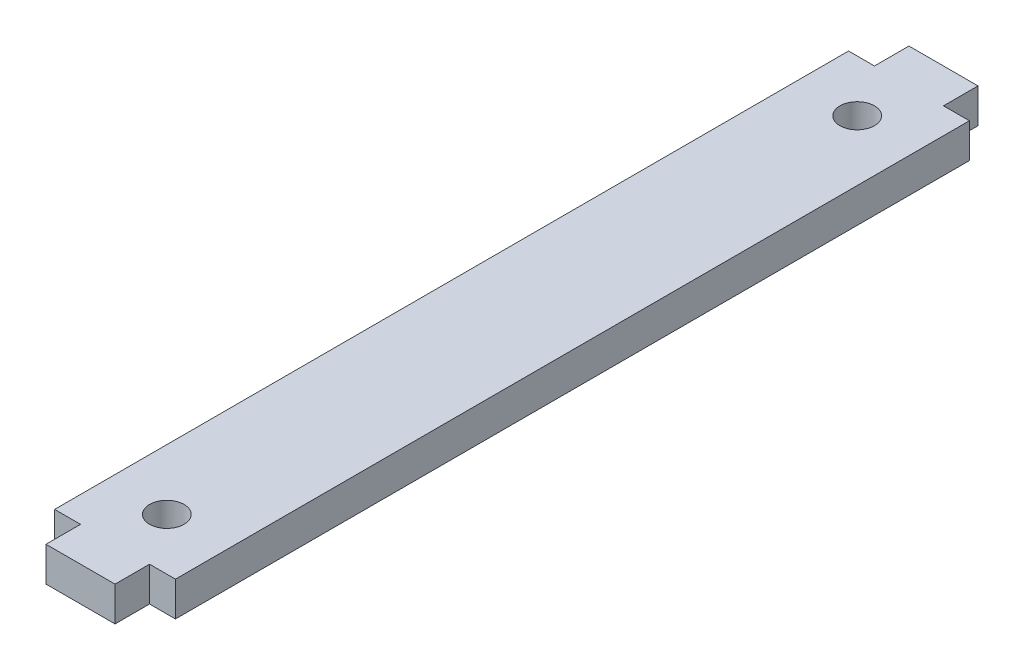
from build123d import *

# Parameters (mm, degrees)
SKETCH1_R           = 2.54
BOSS_EXTRUDE1_DEPTH = 5.08


with BuildPart() as part:
    # Sketch1 → Boss-Extrude1 (new body)
    with BuildSketch(Plane(origin=(0, 0, 0), x_dir=(1, 0, 0), z_dir=(0, 1, 0))):
        Polygon((8.89, -58.42), (8.89, 58.42), (5.08, 58.42), (5.08, 63.5), (-5.08, 63.5), (-5.08, 58.42), (-8.89, 58.42), (-8.89, -58.42), (-5.08, -58.42), (-5.08, -63.5), (5.08, -63.5), (5.08, -58.42), align=None)
        with Locations((0, -50.8)):
            Circle(SKETCH1_R, mode=Mode.SUBTRACT)
        with Locations((0, 50.8)):
            Circle(SKETCH1_R, mode=Mode.SUBTRACT)
    extrude(amount=BOSS_EXTRUDE1_DEPTH)


solid = part.part
